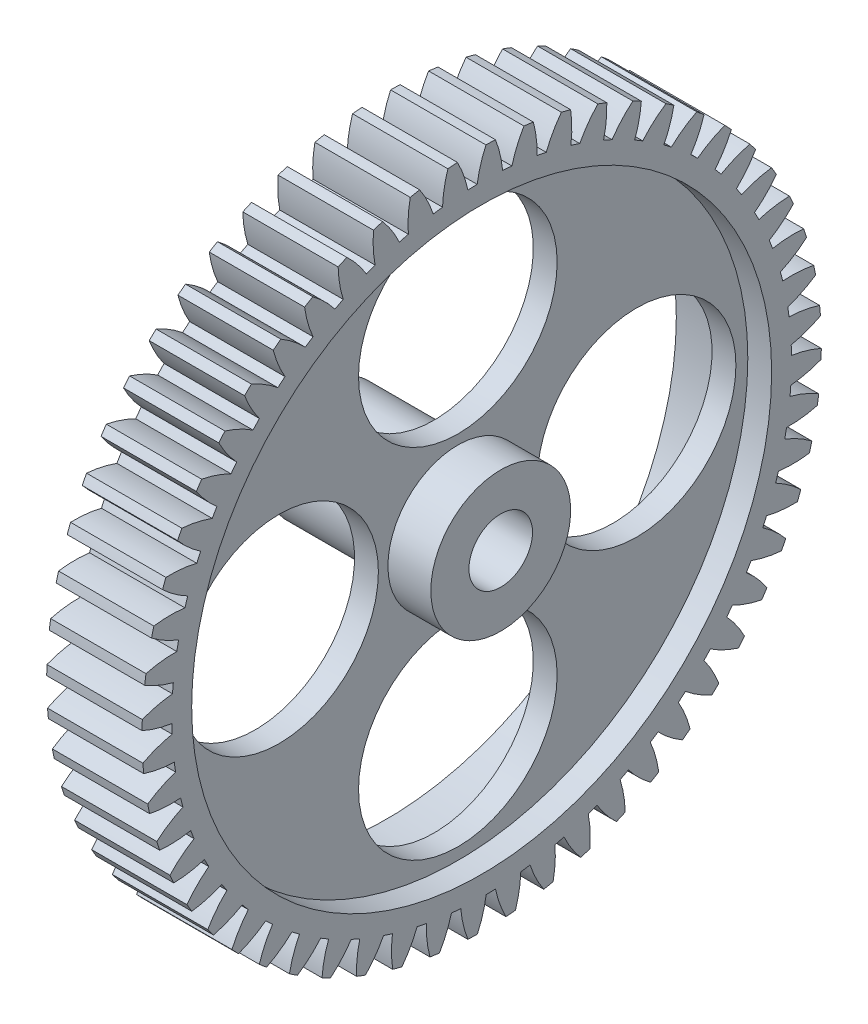
from build123d import *

# Parameters (mm, degrees)
SKETCH1_R           = 12.5
SKETCH1_R_2         = 4
BOSS_EXTRUDE1_DEPTH = 12
SKETCH4_R           = 36.5
CUT_EXTRUDE1_DEPTH  = 3
CUT_EXTRUDE2_START  = -6
SKETCH5_R           = 36.5
CUT_EXTRUDE2_DEPTH  = 6
SKETCH6_R           = 8.8
SKETCH6_R_2         = 4
BOSS_EXTRUDE2_DEPTH = 5.4
BOSS_EXTRUDE3_START = 13.5
SKETCH7_R           = 7.2
SKETCH7_R_2         = 4
BOSS_EXTRUDE3_DEPTH = 13.5


with BuildPart() as part:
    # Sketch1 → Boss-Extrude1 (new body)
    with BuildSketch(Plane(origin=(0, 0, 0), x_dir=(0, 0, -1), z_dir=(1, 0, 0))):
        with BuildLine():
            ThreePointArc((0.536656028, 42.74663145), (-0.145256199, 40.909955783), (-0.563449374, 38.995929593))
            ThreePointArc((-0.563449374, 38.995929593), (-1.15074765, 38.983019122), (-1.737784842, 38.961264146))
            ThreePointArc((-1.737784842, 38.961264146), (-2.268152513, 40.847289576), (-3.057217358, 42.640543172))
            ThreePointArc((-3.057217358, 42.640543172), (-3.655379996, 42.593434906), (-4.252822548, 42.537936015))
            ThreePointArc((-4.252822548, 42.537936015), (-4.724804625, 40.636459034), (-4.92606535, 38.687645058))
            ThreePointArc((-4.92606535, 38.687645058), (-5.508225303, 38.609059222), (-6.089135544, 38.521713725))
            ThreePointArc((-6.089135544, 38.521713725), (-6.827336223, 40.336497885), (-7.812220294, 42.030128647))
            ThreePointArc((-7.812220294, 42.030128647), (-8.401347358, 41.916343621), (-8.988819413, 41.794301353))
            ThreePointArc((-8.988819413, 41.794301353), (-9.244935892, 39.851935234), (-9.226733196, 37.89284094))
            ThreePointArc((-9.226733196, 37.89284094), (-9.796433827, 37.749568001), (-10.363911834, 37.597730404))
            ThreePointArc((-10.363911834, 37.597730404), (-11.30066222, 39.318451329), (-12.468980027, 40.891160868))
            ThreePointArc((-12.468980027, 40.891160868), (-13.041662903, 40.712129995), (-13.611776658, 40.525079102))
            ThreePointArc((-13.611776658, 40.525079102), (-13.648806725, 38.566250226), (-13.411369518, 36.621512362))
            ThreePointArc((-13.411369518, 36.621512362), (-13.961446512, 36.41535406), (-14.508355919, 36.200933807))
            ThreePointArc((-14.508355919, 36.200933807), (-15.631875832, 37.805952435), (-16.968935101, 39.237963015))
            ThreePointArc((-16.968935101, 39.237963015), (-17.51797197, 38.995937712), (-18.063557914, 38.746230468))
            ThreePointArc((-18.063557914, 38.746230468), (-17.881035895, 36.795572245), (-17.427350087, 34.889647017))
            ThreePointArc((-17.427350087, 34.889647017), (-17.950885906, 34.623195913), (-18.47034901, 34.348889464))
            ThreePointArc((-18.47034901, 34.348889464), (-19.766509536, 35.818021753), (-21.255495971, 37.09132501))
            ThreePointArc((-21.255495971, 37.09132501), (-21.773982375, 36.789348887), (-22.288179449, 36.480125505))
            ThreePointArc((-22.288179449, 36.480125505), (-21.888400664, 34.562168594), (-21.224171617, 32.719024117))
            ThreePointArc((-21.224171617, 32.719024117), (-21.714582494, 32.395630988), (-22.200066746, 32.064887907))
            ThreePointArc((-22.200066746, 32.064887907), (-23.652567913, 33.379658666), (-25.274756647, 34.478242073))
            ThreePointArc((-25.274756647, 34.478242073), (-25.756172319, 34.120112654), (-26.232514195, 33.755261797))
            ThreePointArc((-26.232514195, 33.755261797), (-25.620506094, 31.894125619), (-24.754086875, 30.136940505))
            ThreePointArc((-24.754086875, 30.136940505), (-25.205205609, 29.760672207), (-25.650605762, 29.377651779))
            ThreePointArc((-25.650605762, 29.377651779), (-27.241181526, 30.521527004), (-28.976172593, 31.431575237))
            ThreePointArc((-28.976172593, 31.431575237), (-29.414463451, 31.021796207), (-29.846959855, 30.605906088))
            ThreePointArc((-29.846959855, 30.605906088), (-29.030418795, 28.824995509), (-27.972705127, 27.17586738))
            ThreePointArc((-27.972705127, 27.17586738), (-28.378858639, 26.751455706), (-28.778573527, 26.320974635))
            ThreePointArc((-28.778573527, 26.320974635), (-30.487221475, 27.27956943), (-32.313196356, 27.989638105))
            ThreePointArc((-32.313196356, 27.989638105), (-32.702850639, 27.533362673), (-33.086062676, 27.071663351))
            ThreePointArc((-33.086062676, 27.071663351), (-32.075257136, 25.393374356), (-30.839550382, 23.873041955))
            ThreePointArc((-30.839550382, 23.873041955), (-31.195631055, 23.405824127), (-31.544634033, 22.933295963))
            ThreePointArc((-31.544634033, 22.933295963), (-33.349866925, 23.694555443), (-35.243862926, 24.195715035))
            ThreePointArc((-35.243862926, 24.195715035), (-35.579980505, 23.698681129), (-35.909089063, 23.19697874))
            ThreePointArc((-35.909089063, 23.19697874), (-34.716730508, 21.642416787), (-33.318570398, 20.269999177))
            ThreePointArc((-33.318570398, 20.269999177), (-33.620100311, 19.76585073), (-33.914002463, 19.257217788))
            ThreePointArc((-33.914002463, 19.257217788), (-35.793118448, 19.811568673), (-37.731317471, 20.097516809))
            ThreePointArc((-37.731317471, 20.097516809), (-38.009671473, 19.565974919), (-38.28053782, 19.030578662))
            ThreePointArc((-38.28053782, 19.030578662), (-36.921620851, 17.619293269), (-35.378590059, 16.412049397))
            ThreePointArc((-35.378590059, 16.412049397), (-35.621777299, 15.877310291), (-35.856882635, 15.338968926))
            ThreePointArc((-35.856882635, 15.338968926), (-37.786250739, 15.679439933), (-39.744278807, 15.746580648))
            ThreePointArc((-39.744278807, 15.746580648), (-39.961368768, 15.187215222), (-40.170586603, 14.624858016))
            ThreePointArc((-40.170586603, 14.624858016), (-38.662200388, 13.374596916), (-36.993703423, 12.347708574))
            ThreePointArc((-36.993703423, 12.347708574), (-37.175489768, 11.789103464), (-37.348841703, 11.22782363))
            ThreePointArc((-37.348841703, 11.22782363), (-39.304199003, 11.350133137), (-41.257432777, 11.197622099))
            ThreePointArc((-41.257432777, 11.197622099), (-41.410528664, 10.617467482), (-41.555466952, 10.035221295))
            ThreePointArc((-41.555466952, 10.035221295), (-39.916580324, 8.961707246), (-38.143599502, 8.128088151))
            ThreePointArc((-38.143599502, 8.128088151), (-38.261698885, 7.55264182), (-38.371117416, 6.975481938))
            ThreePointArc((-38.371117416, 6.975481938), (-40.32787416, 6.878091832), (-42.251750591, 6.507846956))
            ThreePointArc((-42.251750591, 6.507846956), (-42.338927136, 5.914198928), (-42.417763192, 5.319385843))
            ThreePointArc((-42.417763192, 5.319385843), (-40.668986102, 4.436118908), (-38.813817686, 3.806252304))
            ThreePointArc((-38.813817686, 3.806252304), (-38.866744938, 3.221201323), (-38.910854064, 2.635419512))
            ThreePointArc((-38.910854064, 2.635419512), (-40.844402901, 2.319554532), (-42.714728127, 1.736231861))
            ThreePointArc((-42.714728127, 1.736231861), (-42.734889034, 1.136555891), (-42.74663145, 0.536656028))
            ThreePointArc((-42.74663145, 0.536656028), (-40.909955783, -0.145256199), (-38.995929593, -0.563449374))
            ThreePointArc((-38.995929593, -0.563449374), (-38.983019122, -1.15074765), (-38.961264146, -1.737784842))
            ThreePointArc((-38.961264146, -1.737784842), (-40.847289576, -2.268152513), (-42.640543172, -3.057217358))
            ThreePointArc((-42.640543172, -3.057217358), (-42.593434906, -3.655379996), (-42.537936015, -4.252822548))
            ThreePointArc((-42.537936015, -4.252822548), (-40.636459034, -4.724804625), (-38.687645058, -4.92606535))
            ThreePointArc((-38.687645058, -4.92606535), (-38.609059222, -5.508225303), (-38.521713725, -6.089135544))
            ThreePointArc((-38.521713725, -6.089135544), (-40.336497885, -6.827336223), (-42.030128647, -7.812220294))
            ThreePointArc((-42.030128647, -7.812220294), (-41.916343621, -8.401347358), (-41.794301353, -8.988819413))
            ThreePointArc((-41.794301353, -8.988819413), (-39.851935234, -9.244935892), (-37.89284094, -9.226733196))
            ThreePointArc((-37.89284094, -9.226733196), (-37.749568001, -9.796433827), (-37.597730404, -10.363911834))
            ThreePointArc((-37.597730404, -10.363911834), (-39.318451329, -11.30066222), (-40.891160868, -12.468980027))
            ThreePointArc((-40.891160868, -12.468980027), (-40.712129995, -13.041662903), (-40.525079102, -13.611776658))
            ThreePointArc((-40.525079102, -13.611776658), (-38.566250226, -13.648806725), (-36.621512362, -13.411369518))
            ThreePointArc((-36.621512362, -13.411369518), (-36.41535406, -13.961446512), (-36.200933807, -14.508355919))
            ThreePointArc((-36.200933807, -14.508355919), (-37.805952435, -15.631875832), (-39.237963015, -16.968935101))
            ThreePointArc((-39.237963015, -16.968935101), (-38.995937712, -17.51797197), (-38.746230468, -18.063557914))
            ThreePointArc((-38.746230468, -18.063557914), (-36.795572245, -17.881035895), (-34.889647017, -17.427350087))
            ThreePointArc((-34.889647017, -17.427350087), (-34.623195913, -17.950885906), (-34.348889464, -18.47034901))
            ThreePointArc((-34.348889464, -18.47034901), (-35.818021753, -19.766509536), (-37.09132501, -21.255495971))
            ThreePointArc((-37.09132501, -21.255495971), (-36.789348887, -21.773982375), (-36.480125505, -22.288179449))
            ThreePointArc((-36.480125505, -22.288179449), (-34.562168594, -21.888400664), (-32.719024117, -21.224171617))
            ThreePointArc((-32.719024117, -21.224171617), (-32.395630988, -21.714582494), (-32.064887907, -22.200066746))
            ThreePointArc((-32.064887907, -22.200066746), (-33.379658666, -23.652567913), (-34.478242073, -25.274756647))
            ThreePointArc((-34.478242073, -25.274756647), (-34.120112654, -25.756172319), (-33.755261797, -26.232514195))
            ThreePointArc((-33.755261797, -26.232514195), (-31.894125619, -25.620506094), (-30.136940505, -24.754086875))
            ThreePointArc((-30.136940505, -24.754086875), (-29.760672207, -25.205205609), (-29.377651779, -25.650605762))
            ThreePointArc((-29.377651779, -25.650605762), (-30.521527004, -27.241181526), (-31.431575237, -28.976172593))
            ThreePointArc((-31.431575237, -28.976172593), (-31.021796207, -29.414463451), (-30.605906088, -29.846959855))
            ThreePointArc((-30.605906088, -29.846959855), (-28.824995509, -29.030418795), (-27.17586738, -27.972705127))
            ThreePointArc((-27.17586738, -27.972705127), (-26.751455706, -28.378858639), (-26.320974635, -28.778573527))
            ThreePointArc((-26.320974635, -28.778573527), (-27.27956943, -30.487221475), (-27.989638105, -32.313196356))
            ThreePointArc((-27.989638105, -32.313196356), (-27.533362673, -32.702850639), (-27.071663351, -33.086062676))
            ThreePointArc((-27.071663351, -33.086062676), (-25.393374356, -32.075257136), (-23.873041955, -30.839550382))
            ThreePointArc((-23.873041955, -30.839550382), (-23.405824127, -31.195631055), (-22.933295963, -31.544634033))
            ThreePointArc((-22.933295963, -31.544634033), (-23.694555443, -33.349866925), (-24.195715035, -35.243862926))
            ThreePointArc((-24.195715035, -35.243862926), (-23.698681129, -35.579980505), (-23.19697874, -35.909089063))
            ThreePointArc((-23.19697874, -35.909089063), (-21.642416787, -34.716730508), (-20.269999177, -33.318570398))
            ThreePointArc((-20.269999177, -33.318570398), (-19.76585073, -33.620100311), (-19.257217788, -33.914002463))
            ThreePointArc((-19.257217788, -33.914002463), (-19.811568673, -35.793118448), (-20.097516809, -37.731317471))
            ThreePointArc((-20.097516809, -37.731317471), (-19.565974919, -38.009671473), (-19.030578662, -38.28053782))
            ThreePointArc((-19.030578662, -38.28053782), (-17.619293269, -36.921620851), (-16.412049397, -35.378590059))
            ThreePointArc((-16.412049397, -35.378590059), (-15.877310291, -35.621777299), (-15.338968926, -35.856882635))
            ThreePointArc((-15.338968926, -35.856882635), (-15.679439933, -37.786250739), (-15.746580648, -39.744278807))
            ThreePointArc((-15.746580648, -39.744278807), (-15.187215222, -39.961368768), (-14.624858016, -40.170586603))
            ThreePointArc((-14.624858016, -40.170586603), (-13.374596916, -38.662200388), (-12.347708574, -36.993703423))
            ThreePointArc((-12.347708574, -36.993703423), (-11.789103464, -37.175489768), (-11.22782363, -37.348841703))
            ThreePointArc((-11.22782363, -37.348841703), (-11.350133137, -39.304199003), (-11.197622099, -41.257432777))
            ThreePointArc((-11.197622099, -41.257432777), (-10.617467482, -41.410528664), (-10.035221295, -41.555466952))
            ThreePointArc((-10.035221295, -41.555466952), (-8.961707246, -39.916580324), (-8.128088151, -38.143599502))
            ThreePointArc((-8.128088151, -38.143599502), (-7.55264182, -38.261698885), (-6.975481938, -38.371117416))
            ThreePointArc((-6.975481938, -38.371117416), (-6.878091832, -40.32787416), (-6.507846956, -42.251750591))
            ThreePointArc((-6.507846956, -42.251750591), (-5.914198928, -42.338927136), (-5.319385843, -42.417763192))
            ThreePointArc((-5.319385843, -42.417763192), (-4.436118908, -40.668986102), (-3.806252304, -38.813817686))
            ThreePointArc((-3.806252304, -38.813817686), (-3.221201323, -38.866744938), (-2.635419512, -38.910854064))
            ThreePointArc((-2.635419512, -38.910854064), (-2.319554532, -40.844402901), (-1.736231861, -42.714728127))
            ThreePointArc((-1.736231861, -42.714728127), (-1.136555891, -42.734889034), (-0.536656028, -42.74663145))
            ThreePointArc((-0.536656028, -42.74663145), (0.145256199, -40.909955783), (0.563449374, -38.995929593))
            ThreePointArc((0.563449374, -38.995929593), (1.15074765, -38.983019122), (1.737784842, -38.961264146))
            ThreePointArc((1.737784842, -38.961264146), (2.268152513, -40.847289576), (3.057217358, -42.640543172))
            ThreePointArc((3.057217358, -42.640543172), (3.655379996, -42.593434906), (4.252822548, -42.537936015))
            ThreePointArc((4.252822548, -42.537936015), (4.724804625, -40.636459034), (4.92606535, -38.687645058))
            ThreePointArc((4.92606535, -38.687645058), (5.508225303, -38.609059222), (6.089135544, -38.521713725))
            ThreePointArc((6.089135544, -38.521713725), (6.827336223, -40.336497885), (7.812220294, -42.030128647))
            ThreePointArc((7.812220294, -42.030128647), (8.401347358, -41.916343621), (8.988819413, -41.794301353))
            ThreePointArc((8.988819413, -41.794301353), (9.244935892, -39.851935234), (9.226733196, -37.89284094))
            ThreePointArc((9.226733196, -37.89284094), (9.796433827, -37.749568001), (10.363911834, -37.597730404))
            ThreePointArc((10.363911834, -37.597730404), (11.30066222, -39.318451329), (12.468980027, -40.891160868))
            ThreePointArc((12.468980027, -40.891160868), (13.041662903, -40.712129995), (13.611776658, -40.525079102))
            ThreePointArc((13.611776658, -40.525079102), (13.648806725, -38.566250226), (13.411369518, -36.621512362))
            ThreePointArc((13.411369518, -36.621512362), (13.961446512, -36.41535406), (14.508355919, -36.200933807))
            ThreePointArc((14.508355919, -36.200933807), (15.631875832, -37.805952435), (16.968935101, -39.237963015))
            ThreePointArc((16.968935101, -39.237963015), (17.51797197, -38.995937712), (18.063557914, -38.746230468))
            ThreePointArc((18.063557914, -38.746230468), (17.881035895, -36.795572245), (17.427350087, -34.889647017))
            ThreePointArc((17.427350087, -34.889647017), (17.950885906, -34.623195913), (18.47034901, -34.348889464))
            ThreePointArc((18.47034901, -34.348889464), (19.766509536, -35.818021753), (21.255495971, -37.09132501))
            ThreePointArc((21.255495971, -37.09132501), (21.773982375, -36.789348887), (22.288179449, -36.480125505))
            ThreePointArc((22.288179449, -36.480125505), (21.888400664, -34.562168594), (21.224171617, -32.719024117))
            ThreePointArc((21.224171617, -32.719024117), (21.714582494, -32.395630988), (22.200066746, -32.064887907))
            ThreePointArc((22.200066746, -32.064887907), (23.652567913, -33.379658666), (25.274756647, -34.478242073))
            ThreePointArc((25.274756647, -34.478242073), (25.756172319, -34.120112654), (26.232514195, -33.755261797))
            ThreePointArc((26.232514195, -33.755261797), (25.620506094, -31.894125619), (24.754086875, -30.136940505))
            ThreePointArc((24.754086875, -30.136940505), (25.205205609, -29.760672207), (25.650605762, -29.377651779))
            ThreePointArc((25.650605762, -29.377651779), (27.241181526, -30.521527004), (28.976172593, -31.431575237))
            ThreePointArc((28.976172593, -31.431575237), (29.414463451, -31.021796207), (29.846959855, -30.605906088))
            ThreePointArc((29.846959855, -30.605906088), (29.030418795, -28.824995509), (27.972705127, -27.17586738))
            ThreePointArc((27.972705127, -27.17586738), (28.378858639, -26.751455706), (28.778573527, -26.320974635))
            ThreePointArc((28.778573527, -26.320974635), (30.487221475, -27.27956943), (32.313196356, -27.989638105))
            ThreePointArc((32.313196356, -27.989638105), (32.702850639, -27.533362673), (33.086062676, -27.071663351))
            ThreePointArc((33.086062676, -27.071663351), (32.075257136, -25.393374356), (30.839550382, -23.873041955))
            ThreePointArc((30.839550382, -23.873041955), (31.195631055, -23.405824127), (31.544634033, -22.933295963))
            ThreePointArc((31.544634033, -22.933295963), (33.349866925, -23.694555443), (35.243862926, -24.195715035))
            ThreePointArc((35.243862926, -24.195715035), (35.579980505, -23.698681129), (35.909089063, -23.19697874))
            ThreePointArc((35.909089063, -23.19697874), (34.716730508, -21.642416787), (33.318570398, -20.269999177))
            ThreePointArc((33.318570398, -20.269999177), (33.620100311, -19.76585073), (33.914002463, -19.257217788))
            ThreePointArc((33.914002463, -19.257217788), (35.793118448, -19.811568673), (37.731317471, -20.097516809))
            ThreePointArc((37.731317471, -20.097516809), (38.009671473, -19.565974919), (38.28053782, -19.030578662))
            ThreePointArc((38.28053782, -19.030578662), (36.921620851, -17.619293269), (35.378590059, -16.412049397))
            ThreePointArc((35.378590059, -16.412049397), (35.621777299, -15.877310291), (35.856882635, -15.338968926))
            ThreePointArc((35.856882635, -15.338968926), (37.786250739, -15.679439933), (39.744278807, -15.746580648))
            ThreePointArc((39.744278807, -15.746580648), (39.961368768, -15.187215222), (40.170586603, -14.624858016))
            ThreePointArc((40.170586603, -14.624858016), (38.662200388, -13.374596916), (36.993703423, -12.347708574))
            ThreePointArc((36.993703423, -12.347708574), (37.175489768, -11.789103464), (37.348841703, -11.22782363))
            ThreePointArc((37.348841703, -11.22782363), (39.304199003, -11.350133137), (41.257432777, -11.197622099))
            ThreePointArc((41.257432777, -11.197622099), (41.410528664, -10.617467482), (41.555466952, -10.035221295))
            ThreePointArc((41.555466952, -10.035221295), (39.916580324, -8.961707246), (38.143599502, -8.128088151))
            ThreePointArc((38.143599502, -8.128088151), (38.261698885, -7.55264182), (38.371117416, -6.975481938))
            ThreePointArc((38.371117416, -6.975481938), (40.32787416, -6.878091832), (42.251750591, -6.507846956))
            ThreePointArc((42.251750591, -6.507846956), (42.338927136, -5.914198928), (42.417763192, -5.319385843))
            ThreePointArc((42.417763192, -5.319385843), (40.668986102, -4.436118908), (38.813817686, -3.806252304))
            ThreePointArc((38.813817686, -3.806252304), (38.866744938, -3.221201323), (38.910854064, -2.635419512))
            ThreePointArc((38.910854064, -2.635419512), (40.844402901, -2.319554532), (42.714728127, -1.736231861))
            ThreePointArc((42.714728127, -1.736231861), (42.734889034, -1.136555891), (42.74663145, -0.536656028))
            ThreePointArc((42.74663145, -0.536656028), (40.909955783, 0.145256199), (38.995929593, 0.563449374))
            ThreePointArc((38.995929593, 0.563449374), (38.983019122, 1.15074765), (38.961264146, 1.737784842))
            ThreePointArc((38.961264146, 1.737784842), (40.847289576, 2.268152513), (42.640543172, 3.057217358))
            ThreePointArc((42.640543172, 3.057217358), (42.593434906, 3.655379996), (42.537936015, 4.252822548))
            ThreePointArc((42.537936015, 4.252822548), (40.636459034, 4.724804625), (38.687645058, 4.92606535))
            ThreePointArc((38.687645058, 4.92606535), (38.609059222, 5.508225303), (38.521713725, 6.089135544))
            ThreePointArc((38.521713725, 6.089135544), (40.336497885, 6.827336223), (42.030128647, 7.812220294))
            ThreePointArc((42.030128647, 7.812220294), (41.916343621, 8.401347358), (41.794301353, 8.988819413))
            ThreePointArc((41.794301353, 8.988819413), (39.851935234, 9.244935892), (37.89284094, 9.226733196))
            ThreePointArc((37.89284094, 9.226733196), (37.749568001, 9.796433827), (37.597730404, 10.363911834))
            ThreePointArc((37.597730404, 10.363911834), (39.318451329, 11.30066222), (40.891160868, 12.468980027))
            ThreePointArc((40.891160868, 12.468980027), (40.712129995, 13.041662903), (40.525079102, 13.611776658))
            ThreePointArc((40.525079102, 13.611776658), (38.566250226, 13.648806725), (36.621512362, 13.411369518))
            ThreePointArc((36.621512362, 13.411369518), (36.41535406, 13.961446512), (36.200933807, 14.508355919))
            ThreePointArc((36.200933807, 14.508355919), (37.805952435, 15.631875832), (39.237963015, 16.968935101))
            ThreePointArc((39.237963015, 16.968935101), (38.995937712, 17.51797197), (38.746230468, 18.063557914))
            ThreePointArc((38.746230468, 18.063557914), (36.795572245, 17.881035895), (34.889647017, 17.427350087))
            ThreePointArc((34.889647017, 17.427350087), (34.623195913, 17.950885906), (34.348889464, 18.47034901))
            ThreePointArc((34.348889464, 18.47034901), (35.818021753, 19.766509536), (37.09132501, 21.255495971))
            ThreePointArc((37.09132501, 21.255495971), (36.789348887, 21.773982375), (36.480125505, 22.288179449))
            ThreePointArc((36.480125505, 22.288179449), (34.562168594, 21.888400664), (32.719024117, 21.224171617))
            ThreePointArc((32.719024117, 21.224171617), (32.395630988, 21.714582494), (32.064887907, 22.200066746))
            ThreePointArc((32.064887907, 22.200066746), (33.379658666, 23.652567913), (34.478242073, 25.274756647))
            ThreePointArc((34.478242073, 25.274756647), (34.120112654, 25.756172319), (33.755261797, 26.232514195))
            ThreePointArc((33.755261797, 26.232514195), (31.894125619, 25.620506094), (30.136940505, 24.754086875))
            ThreePointArc((30.136940505, 24.754086875), (29.760672207, 25.205205609), (29.377651779, 25.650605762))
            ThreePointArc((29.377651779, 25.650605762), (30.521527004, 27.241181526), (31.431575237, 28.976172593))
            ThreePointArc((31.431575237, 28.976172593), (31.021796207, 29.414463451), (30.605906088, 29.846959855))
            ThreePointArc((30.605906088, 29.846959855), (28.824995509, 29.030418795), (27.17586738, 27.972705127))
            ThreePointArc((27.17586738, 27.972705127), (26.751455706, 28.378858639), (26.320974635, 28.778573527))
            ThreePointArc((26.320974635, 28.778573527), (27.27956943, 30.487221475), (27.989638105, 32.313196356))
            ThreePointArc((27.989638105, 32.313196356), (27.533362673, 32.702850639), (27.071663351, 33.086062676))
            ThreePointArc((27.071663351, 33.086062676), (25.393374356, 32.075257136), (23.873041955, 30.839550382))
            ThreePointArc((23.873041955, 30.839550382), (23.405824127, 31.195631055), (22.933295963, 31.544634033))
            ThreePointArc((22.933295963, 31.544634033), (23.694555443, 33.349866925), (24.195715035, 35.243862926))
            ThreePointArc((24.195715035, 35.243862926), (23.698681129, 35.579980505), (23.19697874, 35.909089063))
            ThreePointArc((23.19697874, 35.909089063), (21.642416787, 34.716730508), (20.269999177, 33.318570398))
            ThreePointArc((20.269999177, 33.318570398), (19.76585073, 33.620100311), (19.257217788, 33.914002463))
            ThreePointArc((19.257217788, 33.914002463), (19.811568673, 35.793118448), (20.097516809, 37.731317471))
            ThreePointArc((20.097516809, 37.731317471), (19.565974919, 38.009671473), (19.030578662, 38.28053782))
            ThreePointArc((19.030578662, 38.28053782), (17.619293269, 36.921620851), (16.412049397, 35.378590059))
            ThreePointArc((16.412049397, 35.378590059), (15.877310291, 35.621777299), (15.338968926, 35.856882635))
            ThreePointArc((15.338968926, 35.856882635), (15.679439933, 37.786250739), (15.746580648, 39.744278807))
            ThreePointArc((15.746580648, 39.744278807), (15.187215222, 39.961368768), (14.624858016, 40.170586603))
            ThreePointArc((14.624858016, 40.170586603), (13.374596916, 38.662200388), (12.347708574, 36.993703423))
            ThreePointArc((12.347708574, 36.993703423), (11.789103464, 37.175489768), (11.22782363, 37.348841703))
            ThreePointArc((11.22782363, 37.348841703), (11.350133137, 39.304199003), (11.197622099, 41.257432777))
            ThreePointArc((11.197622099, 41.257432777), (10.617467482, 41.410528664), (10.035221295, 41.555466952))
            ThreePointArc((10.035221295, 41.555466952), (8.961707246, 39.916580324), (8.128088151, 38.143599502))
            ThreePointArc((8.128088151, 38.143599502), (7.55264182, 38.261698885), (6.975481938, 38.371117416))
            ThreePointArc((6.975481938, 38.371117416), (6.878091832, 40.32787416), (6.507846956, 42.251750591))
            ThreePointArc((6.507846956, 42.251750591), (5.914198928, 42.338927136), (5.319385843, 42.417763192))
            ThreePointArc((5.319385843, 42.417763192), (4.436118908, 40.668986102), (3.806252304, 38.813817686))
            ThreePointArc((3.806252304, 38.813817686), (3.221201323, 38.866744938), (2.635419512, 38.910854064))
            ThreePointArc((2.635419512, 38.910854064), (2.319554532, 40.844402901), (1.736231861, 42.714728127))
            ThreePointArc((1.736231861, 42.714728127), (1.136555891, 42.734889034), (0.536656028, 42.74663145))
        make_face()
        with Locations((0, 22.5)):
            Circle(SKETCH1_R, mode=Mode.SUBTRACT)
        with Locations((0, -22.5)):
            Circle(SKETCH1_R, mode=Mode.SUBTRACT)
        with Locations((22.5, 0)):
            Circle(SKETCH1_R, mode=Mode.SUBTRACT)
        with Locations((-22.5, 0)):
            Circle(SKETCH1_R, mode=Mode.SUBTRACT)
        Circle(SKETCH1_R_2, mode=Mode.SUBTRACT)
    extrude(amount=BOSS_EXTRUDE1_DEPTH)

    # Sketch4 → Cut-Extrude1 (cut)
    with BuildSketch(Plane(origin=(12, 0, 0), x_dir=(0, 0, -1), z_dir=(1, 0, 0))):
        Circle(SKETCH4_R)
    extrude(amount=-CUT_EXTRUDE1_DEPTH, mode=Mode.SUBTRACT)

    # Sketch5 → Cut-Extrude2 (cut)
    with BuildSketch(Plane.ZY.offset(CUT_EXTRUDE2_START)):
        Circle(SKETCH5_R)
    extrude(amount=CUT_EXTRUDE2_DEPTH, mode=Mode.SUBTRACT)

    # Sketch6 → Boss-Extrude2 (add)
    with BuildSketch(Plane(origin=(9, 0, 0), x_dir=(0, 0, -1), z_dir=(1, 0, 0))):
        Circle(SKETCH6_R)
        Circle(SKETCH6_R_2, mode=Mode.SUBTRACT)
    extrude(amount=BOSS_EXTRUDE2_DEPTH)

    # Sketch7 → Boss-Extrude3 (add)
    with BuildSketch(Plane.ZY.offset(-6).offset(BOSS_EXTRUDE3_START)):
        Circle(SKETCH7_R)
        Circle(SKETCH7_R_2, mode=Mode.SUBTRACT)
    extrude(amount=-BOSS_EXTRUDE3_DEPTH)


solid = part.part
